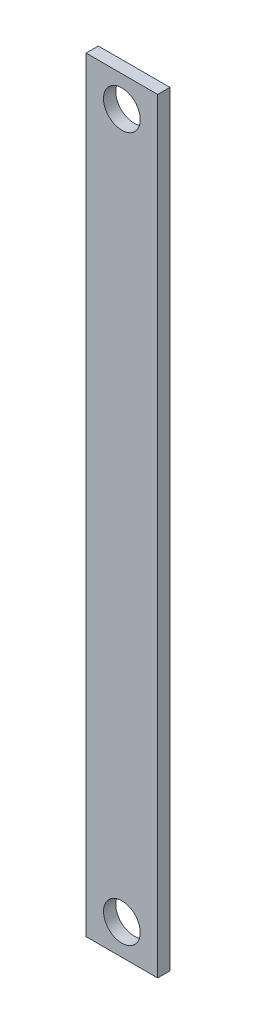
from build123d import *

# Parameters (mm, degrees)
SKETCH1_W           = 11.7
SKETCH1_H           = 125
BOSS_EXTRUDE1_DEPTH = 1
SKETCH2_R           = 3
CUT_EXTRUDE1_DEPTH  = 63.805035626


with BuildPart() as part:
    # Sketch1 → Boss-Extrude1 (new, symmetric)
    with BuildSketch(Plane.XY):
        Rectangle(SKETCH1_W, SKETCH1_H)
    extrude(amount=BOSS_EXTRUDE1_DEPTH, both=True)

    # Sketch2 → Cut-Extrude1 (cut, through all)
    with BuildSketch(Plane.XY.offset(1)):
        with Locations((0, 57.5)):
            Circle(SKETCH2_R)
        with Locations((0, -57.5)):
            Circle(SKETCH2_R)
    extrude(amount=-CUT_EXTRUDE1_DEPTH, mode=Mode.SUBTRACT)


solid = part.part
